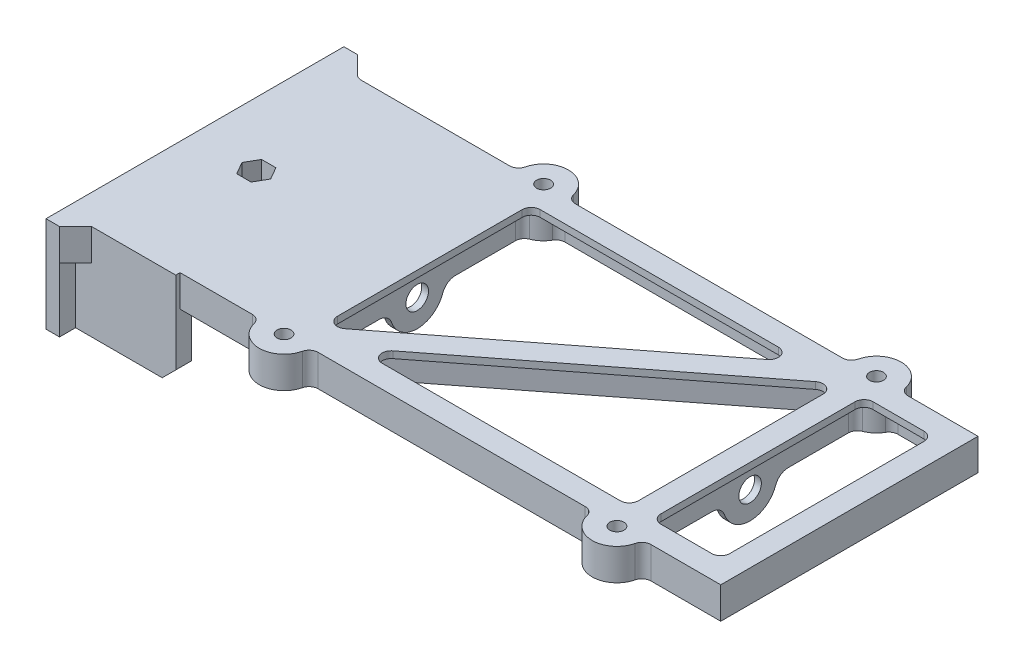
from build123d import *
from build123d.topology import SkipClean

# Parameters (mm, degrees)
SKETCH1_W            = 145
SKETCH1_H            = 57
BOSS_EXTRUDE1_DEPTH  = 1.5
SKETCH2_W            = 3
SKETCH2_H            = 66
BOSS_EXTRUDE2_DEPTH  = 21.2
CHAMFER1_SIZE        = 4.5
SKETCH3_W            = 9.5
SKETCH3_H            = 63
SKETCH3_R            = 1.55
BOSS_EXTRUDE3_DEPTH  = 1.5
SKETCH4_R            = 1.55
CUT_EXTRUDE1_DEPTH   = 83.056931456
SKETCH5_W            = 6
SKETCH5_H            = 9.5
BOSS_EXTRUDE4_DEPTH  = 19.7
CUT_EXTRUDE2_START   = -1
SKETCH6_W            = 5.5
SKETCH6_H            = 5.5
CUT_EXTRUDE2_DEPTH   = 1.8
CUT_EXTRUDE3_REACH   = 84.43
SKETCH7_R            = 1.6
SKETCH10_W           = 15.25
SKETCH10_H           = 47
CUT_EXTRUDE6_DEPTH   = 83.056931456
FILLET1_R            = 2
BOSS_EXTRUDE5_START  = 5.5
SKETCH11_W           = 9.5
SKETCH11_H           = 5
SKETCH11_R           = 1.55
BOSS_EXTRUDE5_DEPTH  = 5.5
SKETCH12_W           = 64.25
SKETCH12_H           = 1.5
SKETCH12_W_2         = 1.5
SKETCH12_H_2         = 53
BOSS_EXTRUDE6_DEPTH  = 5.5
BOSS_EXTRUDE7_START  = -7
SKETCH13_R           = 5.4886246
BOSS_EXTRUDE7_DEPTH  = 7
SKETCH14_R           = 3.125
CUT_EXTRUDE7_DEPTH   = 3
SKETCH15_R           = 1.55
CUT_EXTRUDE8_DEPTH   = 83.002276886
FILLET2_R            = 2
FILLET3_R            = 1
SKETCH20_R           = 6
BOSS_EXTRUDE9_DEPTH  = 1.5
BOSS_EXTRUDE10_START = -73.75
SKETCH20_2_R         = 6
BOSS_EXTRUDE10_DEPTH = 1.5
CUT_EXTRUDE13_REACH  = 129.76
SKETCH21_R           = 2.5
CUT_EXTRUDE14_START  = 72.25
SKETCH21_2_R         = 2.5
CUT_EXTRUDE14_DEPTH  = 1.5
FILLET4_R            = 3
SKETCH25_R           = 1.6
CUT_EXTRUDE16_DEPTH  = 3
SKETCH27_W           = 13
SKETCH27_H           = 6.35
CUT_EXTRUDE18_DEPTH  = 3
SKETCH26_R           = 3.125
CUT_EXTRUDE17_DEPTH  = 2
SKETCH29_W           = 13
SKETCH29_H           = 1.5
CUT_EXTRUDE19_DEPTH  = 3
SKETCH28_W           = 2
SKETCH28_H           = 14
BOSS_EXTRUDE13_DEPTH = 1
CHAMFER3_SIZE        = 1
CUT_EXTRUDE15_DEPTH  = 3
BOSS_EXTRUDE11_START = -1.5
SKETCH23_W           = 16.2
SKETCH23_H           = 3
SKETCH23_W_2         = 19.2
SKETCH23_H_2         = 3.5
BOSS_EXTRUDE11_DEPTH = 7
SKETCH30_W           = 19.2
SKETCH30_H           = 21.2
BOSS_EXTRUDE14_DEPTH = 3.5
SKETCH31_W           = 6.852894631
SKETCH31_H           = 16.7
CUT_EXTRUDE20_DEPTH  = 1
SKETCH33_W           = 19.2
SKETCH33_H           = 14.2
SKETCH33_W_2         = 10.2
SKETCH33_H_2         = 3.2
BOSS_EXTRUDE15_DEPTH = 3.5
BOSS_EXTRUDE16_DEPTH = 5.5
CUT_EXTRUDE21_START  = -7
CUT_EXTRUDE21_DEPTH  = 5
SKETCH36_R           = 1.6
CUT_EXTRUDE22_DEPTH  = 82.425876811
BOSS_EXTRUDE17_REACH = 100.492
SKETCH37_W           = 3
SKETCH37_H           = 21.2
SKETCH38_W           = 5.5
SKETCH38_H           = 1.8
CUT_EXTRUDE23_DEPTH  = 0.1
SKETCH39_W           = 10.2
SKETCH39_H           = 3.2
BOSS_EXTRUDE18_DEPTH = 0.8
CHAMFER4_SIZE        = 3
SKETCH40_W           = 15
SKETCH40_H           = 2.5
SKETCH40_W_2         = 2.35
SKETCH40_H_2         = 15
SKETCH40_H_3         = 1.5
BOSS_EXTRUDE19_DEPTH = 1.2
SKETCH41_W           = 15
SKETCH41_H           = 2.5
SKETCH41_W_2         = 2.35
SKETCH41_H_2         = 15
BOSS_EXTRUDE20_DEPTH = 1.5


# Some blends are built 0.0001 mm under size
with BuildPart() as part:
    # Sketch1 → Boss-Extrude1 (new body)
    with BuildSketch(Plane(origin=(0, 0, 0), x_dir=(1, 0, 0), z_dir=(0, 1, 0))):
        Rectangle(SKETCH1_W, SKETCH1_H)
    extrude(amount=BOSS_EXTRUDE1_DEPTH)

    # Sketch2 → Boss-Extrude2 (add)
    with BuildSketch(Plane(origin=(0, 1.5, 0), x_dir=(1, 0, 0), z_dir=(0, 1, 0))):
        with Locations((-71, 0)):
            Rectangle(SKETCH2_W, SKETCH2_H)
    extrude(amount=-BOSS_EXTRUDE2_DEPTH)

    # Chamfer1
    chamfer1_edges = [part.edges().sort_by_distance(p)[0] for p in [
        (-69.5, 0.75, -28.5),
        (-69.5, 0.75, 28.5),
    ]]
    chamfer(chamfer1_edges, length=CHAMFER1_SIZE - 0.0001)  # a hair under: the kernel refuses the full size

    # Sketch3 → Boss-Extrude3 (add)
    # profile 1 of 2: a face of its own
    with BuildSketch(Plane.XZ):
        with Locations((49.75, 0)):
            Rectangle(SKETCH3_W, SKETCH3_H)
        with Locations((49.75, 28.75)):
            Circle(SKETCH3_R, mode=Mode.SUBTRACT)
        with Locations((49.75, -28.75)):
            Circle(SKETCH3_R, mode=Mode.SUBTRACT)
    # profile 2 of 2: a face of its own
    with BuildSketch(Plane.XZ):
        with Locations((-24, 0)):
            Rectangle(SKETCH3_W, SKETCH3_H)
        with Locations((-24, -28.75)):
            Circle(SKETCH3_R, mode=Mode.SUBTRACT)
        with Locations((-24, 28.75)):
            Circle(SKETCH3_R, mode=Mode.SUBTRACT)
    extrude(amount=-BOSS_EXTRUDE3_DEPTH)

    # Sketch4 → Cut-Extrude1 (cut, through all)
    with BuildSketch(Plane.XZ):
        with Locations(Location((49.75, 28.75, 0), (0, 0, 270))):
            Circle(SKETCH4_R)
        with Locations(Location((49.75, -28.75, 0), (0, 0, 270))):
            Circle(SKETCH4_R)
        with Locations(Location((-24, -28.75, 0), (0, 0, 270))):
            Circle(SKETCH4_R)
        with Locations(Location((-24, 28.75, 0), (0, 0, 270))):
            Circle(SKETCH4_R)
    extrude(amount=-CUT_EXTRUDE1_DEPTH, mode=Mode.SUBTRACT)

    # Sketch5 → Boss-Extrude4 (add)
    with BuildSketch(Plane.XZ.offset(19.7)):
        with Locations((-69.5, 0)):
            Rectangle(SKETCH5_W, SKETCH5_H)
    extrude(amount=-BOSS_EXTRUDE4_DEPTH)

    # Sketch6 → Cut-Extrude2 (cut)
    with BuildSketch(Plane.XZ.offset(19.7).offset(CUT_EXTRUDE2_START)):
        with Locations((-69.25, 0)):
            Rectangle(SKETCH6_W, SKETCH6_H)
    extrude(amount=-CUT_EXTRUDE2_DEPTH, mode=Mode.SUBTRACT)

    # Cut-Extrude3: up to this face of the body (flat: up to its plane)
    cut_extrude3_end = Plane(part.part.faces().sort_by_distance((1.686884961, 0, 0))[0])
    # Sketch7 → Cut-Extrude3 (cut, up to the picked face)
    with BuildSketch(Plane.XZ.offset(19.7), mode=Mode.PRIVATE) as cut_extrude3_sk1:
        with Locations(Location((-69.25, 0, 0), (0, 0, 270))):
            Circle(SKETCH7_R)
    cut_extrude3_tool1 = split(extrude(cut_extrude3_sk1.sketch, amount=-CUT_EXTRUDE3_REACH, mode=Mode.PRIVATE), bisect_by=cut_extrude3_end, keep=Keep.BOTH, mode=Mode.PRIVATE)
    add(cut_extrude3_tool1.solids().sort_by(Axis((-69.25, -19.7, 0), (0, 1, 0)))[0], mode=Mode.SUBTRACT)

    # Sketch10 → Cut-Extrude6 (cut, through all)
    with BuildSketch(Plane.XZ):
        Polygon((-21.5, 23.5), (39.092146805, -23.5), (-21.5, -23.5), align=None)
        Polygon((47.25, -23.5), (47.25, 23.5), (-13.342146805, 23.5), align=None)
        with Locations((59.875, 0)):
            Rectangle(SKETCH10_W, SKETCH10_H)
    extrude(amount=-CUT_EXTRUDE6_DEPTH, mode=Mode.SUBTRACT)

    # Fillet1
    fillet1_edges = [part.edges().sort_by_distance(p)[0] for p in [
        (52.25, 0.75, -23.5),
        (52.25, 0.75, 23.5),
        (67.5, 0.75, 23.5),
        (67.5, 0.75, -23.5),
        (47.25, 0.75, -23.5),
        (-13.342146805, 0.75, 23.5),
        (47.25, 0.75, 23.5),
        (-21.5, 0.75, -23.5),
        (-21.5, 0.75, 23.5),
        (39.092146805, 0.75, -23.5),
    ]]
    fillet(fillet1_edges, radius=FILLET1_R)

    # Sketch11 → Boss-Extrude5 (add)
    # profile 1 of 4: a face of its own
    with BuildSketch(Plane.XZ.offset(BOSS_EXTRUDE5_START)):
        with Locations((-24, 29)):
            Rectangle(SKETCH11_W, SKETCH11_H)
        with Locations(Location((-24, 28.75, 0), (0, 0, 270))):
            Circle(SKETCH11_R, mode=Mode.SUBTRACT)
    # profile 2 of 4: a face of its own
    with BuildSketch(Plane.XZ.offset(BOSS_EXTRUDE5_START)):
        with Locations((-24, -29)):
            Rectangle(SKETCH11_W, SKETCH11_H)
        with Locations(Location((-24, -28.75, 0), (0, 0, 270))):
            Circle(SKETCH11_R, mode=Mode.SUBTRACT)
    # profile 3 of 4: a face of its own
    with BuildSketch(Plane.XZ.offset(BOSS_EXTRUDE5_START)):
        with Locations((49.75, -29)):
            Rectangle(SKETCH11_W, SKETCH11_H)
        with Locations(Location((49.75, -28.75, 0), (0, 0, 270))):
            Circle(SKETCH11_R, mode=Mode.SUBTRACT)
    # profile 4 of 4: a face of its own
    with BuildSketch(Plane.XZ.offset(BOSS_EXTRUDE5_START)):
        with Locations((49.75, 29)):
            Rectangle(SKETCH11_W, SKETCH11_H)
        with Locations(Location((49.75, 28.75, 0), (0, 0, 270))):
            Circle(SKETCH11_R, mode=Mode.SUBTRACT)
    extrude(amount=-BOSS_EXTRUDE5_DEPTH)

    # Sketch12 → Boss-Extrude6 (add)
    with SkipClean():  # the faces are left unmerged after this step: merging them gives an invalid solid
        with BuildSketch(Plane.XZ.offset(5.5)):
            with Locations((12.875, -27.75)):
                Rectangle(SKETCH12_W, SKETCH12_H)
            with Locations((12.875, 27.75)):
                Rectangle(SKETCH12_W, SKETCH12_H)
            Polygon((-28.75, 28.5), (-65, 28.5), (-69.5, 33), (-70.560660172, 31.939339828), (-65.621320344, 27), (-28.75, 27), align=None)
            Polygon((54.5, 28.5), (72.5, 28.5), (72.5, -28.5), (54.5, -28.5), (54.5, -27), (71, -27), (71, 27), (54.5, 27), align=None)
            with Locations((-24, 0)):
                Rectangle(SKETCH12_W_2, SKETCH12_H_2)
            Polygon((-24.461149181, 28.158526051), (49.288850819, -29.341473949), (50.211149181, -28.158526051), (-23.538850819, 29.341473949), align=None)
            with Locations((49.75, 0)):
                Rectangle(SKETCH12_W_2, SKETCH12_H_2)
            Polygon((-69.5, -33), (-70.560660172, -31.939339828), (-65.621320344, -27), (-28.75, -27), (-28.75, -28.5), (-65, -28.5), align=None)
        extrude(amount=-BOSS_EXTRUDE6_DEPTH)

    # Sketch13 → Boss-Extrude7 (add)
    with SkipClean():  # the faces are left unmerged after this step: merging them gives an invalid solid
        with BuildSketch(Plane.XZ.offset(5.5).offset(BOSS_EXTRUDE7_START)):
            with Locations((-24, 28.75)):
                Circle(SKETCH13_R)
            with Locations((-24, -28.75)):
                Circle(SKETCH13_R)
            with Locations((49.75, -28.75)):
                Circle(SKETCH13_R)
            with Locations((49.75, 28.75)):
                Circle(SKETCH13_R)
        extrude(amount=BOSS_EXTRUDE7_DEPTH)

    # Sketch14 → Cut-Extrude7 (cut)
    with SkipClean():  # the faces are left unmerged after this step: merging them gives an invalid solid
        with BuildSketch(Plane.XZ.offset(5.5)):
            with Locations(Location((49.75, -28.75, 0), (0, 0, 270))):
                Circle(SKETCH14_R)
            with Locations(Location((49.75, 28.75, 0), (0, 0, 270))):
                Circle(SKETCH14_R)
            with Locations(Location((-24, -28.75, 0), (0, 0, 270))):
                Circle(SKETCH14_R)
            with Locations(Location((-24, 28.75, 0), (0, 0, 270))):
                Circle(SKETCH14_R)
        extrude(amount=-CUT_EXTRUDE7_DEPTH, mode=Mode.SUBTRACT)

    # Sketch15 → Cut-Extrude8 (cut, through all)
    with SkipClean():  # the faces are left unmerged after this step: merging them gives an invalid solid
        with BuildSketch(Plane.XZ.offset(2.5)):
            with Locations(Location((49.75, 28.75, 0), (0, 0, 270))):
                Circle(SKETCH15_R)
            with Locations(Location((49.75, -28.75, 0), (0, 0, 270))):
                Circle(SKETCH15_R)
            with Locations(Location((-24, -28.75, 0), (0, 0, 270))):
                Circle(SKETCH15_R)
            with Locations(Location((-24, 28.75, 0), (0, 0, 270))):
                Circle(SKETCH15_R)
        extrude(amount=-CUT_EXTRUDE8_DEPTH, mode=Mode.SUBTRACT)

    # Fillet2
    # the kernel refuses this fillet: 2 mm, written as the material it adds along each edge
    with BuildSketch(Plane(origin=(-65, -5.5, -28.5), x_dir=(-0.7071067811865518, 0, -0.7071067811865432), z_dir=(0, 1, 0))) as fillet2_piece_1:
        with BuildLine():
            CenterArc((FILLET2_R * 0.414213562373, -FILLET2_R), FILLET2_R, 90, 45)
            Line((-FILLET2_R * 0.292893218813, -FILLET2_R * 0.292893218813), (0, 0))
            Line((0, 0), (FILLET2_R * 0.414213562373, 0))
        make_face()
    extrude(amount=5.5)
    with BuildSketch(Plane(origin=(-65, -5.5, 28.5), x_dir=(-0.7071067811865455, 0, 0.7071067811865497), z_dir=(0, 1, 0))) as fillet2_piece_2:
        with BuildLine():
            CenterArc((FILLET2_R * 0.414213562373, FILLET2_R), FILLET2_R, 225, 45)
            Line((-FILLET2_R * 0.292893218813, FILLET2_R * 0.292893218813), (0, 0))
            Line((0, 0), (FILLET2_R * 0.414213562373, 0))
        make_face()
    extrude(amount=5.5)
    with BuildSketch(Plane(origin=(-18.51707195, -5.5, 28.5), x_dir=(1, 0, 0), z_dir=(0, 1, 0)), Plane(origin=(-29.48292805, -5.5, -28.5), x_dir=(-1, 0, 0), z_dir=(0, 1, 0)), Plane(origin=(44.26707195, -5.5, -28.5), x_dir=(-1, 0, 0), z_dir=(0, 1, 0)), Plane(origin=(55.23292805, -5.5, 28.5), x_dir=(1, 0, 0), z_dir=(0, 1, 0))) as fillet2_piece_3:
        with BuildLine():
            CenterArc((1.798349201, -2), FILLET2_R, 90, 76.485715936)
            ThreePointArc((-0.146274182, -1.532624455), (-0.019131508, -0.771466538), (0, 0))
            Line((0, 0), (1.798349201, 0))
        make_face()
    extrude(amount=5.5)
    with BuildSketch(Plane(origin=(-29.48292805, -5.5, 28.5), x_dir=(-1, 0, 0), z_dir=(0, 1, 0)), Plane(origin=(-18.51707195, -5.5, -28.5), x_dir=(1, 0, 0), z_dir=(0, 1, 0)), Plane(origin=(55.23292805, -5.5, -28.5), x_dir=(1, 0, 0), z_dir=(0, 1, 0)), Plane(origin=(44.26707195, -5.5, 28.5), x_dir=(-1, 0, 0), z_dir=(0, 1, 0))) as fillet2_piece_4:
        with BuildLine():
            CenterArc((1.798349201, 2), FILLET2_R, 193.514284064, 76.485715936)
            ThreePointArc((-0.146274182, 1.532624455), (-0.019131508, 0.771466538), (0, 0))
            Line((0, 0), (1.798349201, 0))
        make_face()
    extrude(amount=5.5)
    with BuildSketch(Plane(origin=(-29.202163012, -5.5, 27), x_dir=(-1, 0, 0), z_dir=(0, 1, 0))) as fillet2_piece_5:
        with BuildLine():
            CenterArc((1.279889009, -2), FILLET2_R, 90, 59.949738358)
            ThreePointArc((-0.451283901, -0.998480976), (-0.200662943, -0.510530261), (0, 0))
            Line((0, 0), (1.279889009, 0))
        make_face()
    extrude(amount=5.5)
    with BuildSketch(Plane(origin=(-24.75, -5.5, 23.312859207), x_dir=(0, 0, -1), z_dir=(0, 1, 0)), Plane(origin=(-20.17324633, -5.5, 24.815415353), x_dir=(0.7886319326366397, 0, -0.6148655745980567), z_dir=(0, 1, 0)), Plane(origin=(49, -5.5, 23.312859207), x_dir=(0, 0, -1), z_dir=(0, 1, 0))) as fillet2_piece_6:
        with BuildLine():
            CenterArc((1.528273653, 2), FILLET2_R, 201.544493666, 68.455506334)
            ThreePointArc((-0.331991701, 1.265552716), (-0.128150783, 0.642704232), (0, 0))
            Line((0, 0), (1.528273653, 0))
        make_face()
    extrude(amount=5.5)
    with BuildSketch(Plane(origin=(-23.25, -5.5, 23.312859207), x_dir=(0.9672714744497951, 0, 0.2537437579837566), z_dir=(0, 1, 0)), Plane(origin=(-24.75, -5.5, -23.312859207), x_dir=(-0.9672714744497954, 0, -0.253743757983756), z_dir=(0, 1, 0)), Plane(origin=(49, -5.5, -23.312859207), x_dir=(-0.9672714744497944, 0, -0.25374375798375987), z_dir=(0, 1, 0)), Plane(origin=(50.5, -5.5, 23.312859207), x_dir=(0.9672714744497954, 0, 0.253743757983756), z_dir=(0, 1, 0))) as fillet2_piece_7:
        with BuildLine():
            CenterArc((1.546753049, 1.985743026), FILLET2_R, 194.699159663, 68.455506334)
            Line((-0.3877899, 1.47825551), (0, 0))
            ThreePointArc((0, 0), (0.654186932, 0.03912559), (1.308373863, 0))
        make_face()
    extrude(amount=5.5)
    with BuildSketch(Plane(origin=(-18.797836988, -5.5, 27), x_dir=(1, 0, 0), z_dir=(0, 1, 0)), Plane(origin=(-29.202163012, -5.5, -27), x_dir=(-1, 0, 0), z_dir=(0, 1, 0)), Plane(origin=(44.547836988, -5.5, -27), x_dir=(-1, 0, 0), z_dir=(0, 1, 0)), Plane(origin=(54.952163012, -5.5, 27), x_dir=(1, 0, 0), z_dir=(0, 1, 0))) as fillet2_piece_8:
        with BuildLine():
            CenterArc((1.279889009, 2), FILLET2_R, 210.050261642, 59.949738358)
            ThreePointArc((-0.451283901, 0.998480976), (-0.200662943, 0.510530261), (0, 0))
            Line((0, 0), (1.279889009, 0))
        make_face()
    extrude(amount=5.5)
    with BuildSketch(Plane(origin=(-18.797836988, -5.5, -27), x_dir=(-0.41185732786672785, 0, 0.9112483423757097), z_dir=(0, 1, 0)), Plane(origin=(54.952163012, -5.5, -27), x_dir=(-0.4118573278667254, 0, 0.9112483423757108), z_dir=(0, 1, 0)), Plane(origin=(44.547836988, -5.5, 27), x_dir=(0.4118573278667266, 0, -0.9112483423757102), z_dir=(0, 1, 0))) as fillet2_piece_9:
        with BuildLine():
            CenterArc((1.295365017, 1.990011394), FILLET2_R, 204.32156275, 59.949738358)
            Line((-0.527131667, 1.166296738), (0, 0))
            ThreePointArc((0, 0), (0.547864358, 0.027411855), (1.095728716, 0))
        make_face()
    extrude(amount=5.5)
    with BuildSketch(Plane(origin=(-23.25, -5.5, -23.312859207), x_dir=(0.9672714744497951, 0, -0.2537437579837566), z_dir=(0, 1, 0)), Plane(origin=(50.5, -5.5, -23.312859207), x_dir=(0.9672714744497961, 0, -0.2537437579837534), z_dir=(0, 1, 0)), Plane(origin=(45.92324633, -5.5, -24.815415353), x_dir=(0.7948523611830938, 0, 0.6068028707262851), z_dir=(0, 1, 0))) as fillet2_piece_10:
        with BuildLine():
            CenterArc((1.546753049, -1.985743026), FILLET2_R, 96.845334003, 68.455506334)
            Line((-0.3877899, -1.47825551), (0, 0))
            ThreePointArc((0, 0), (0.654186932, -0.03912559), (1.308373863, 0))
        make_face()
    extrude(amount=5.5)
    with BuildSketch(Plane(origin=(55.23292805, 0, 28.5), x_dir=(1, 0, 0), z_dir=(0, 1, 0)), Plane(origin=(44.26707195, 0, -28.5), x_dir=(-1, 0, 0), z_dir=(0, 1, 0)), Plane(origin=(-29.48292805, 0, -28.5), x_dir=(-1, 0, 0), z_dir=(0, 1, 0)), Plane(origin=(-18.51707195, 0, 28.5), x_dir=(1, 0, 0), z_dir=(0, 1, 0))) as fillet2_piece_11:
        with BuildLine():
            CenterArc((1.798349201, -2), FILLET2_R, 90, 76.485715936)
            ThreePointArc((-0.146274182, -1.532624455), (-0.019131508, -0.771466538), (0, 0))
            Line((0, 0), (1.798349201, 0))
        make_face()
    extrude(amount=1.5)
    with BuildSketch(Plane(origin=(44.26707195, 0, 28.5), x_dir=(-1, 0, 0), z_dir=(0, 1, 0)), Plane(origin=(55.23292805, 0, -28.5), x_dir=(1, 0, 0), z_dir=(0, 1, 0)), Plane(origin=(-18.51707195, 0, -28.5), x_dir=(1, 0, 0), z_dir=(0, 1, 0)), Plane(origin=(-29.48292805, 0, 28.5), x_dir=(-1, 0, 0), z_dir=(0, 1, 0))) as fillet2_piece_12:
        with BuildLine():
            CenterArc((1.798349201, 2), FILLET2_R, 193.514284064, 76.485715936)
            ThreePointArc((-0.146274182, 1.532624455), (-0.019131508, 0.771466538), (0, 0))
            Line((0, 0), (1.798349201, 0))
        make_face()
    extrude(amount=1.5)
    with BuildSketch(Plane(origin=(-65.0001, 0, 28.5), x_dir=(1, 0, 0), z_dir=(0, 1, 0))) as fillet2_piece_13:
        with BuildLine():
            CenterArc((FILLET2_R * 0.414213562373, -FILLET2_R), FILLET2_R, 90, 45)
            Line((-FILLET2_R * 0.292893218813, -FILLET2_R * 0.292893218813), (0, 0))
            Line((0, 0), (FILLET2_R * 0.414213562373, 0))
        make_face()
    extrude(amount=1.5)
    with BuildSketch(Plane(origin=(-65.0001, 1.5, -28.5), x_dir=(-0.7071067811865432, 0, -0.7071067811865518), z_dir=(0, -1, 0))) as fillet2_piece_14:
        with BuildLine():
            CenterArc((FILLET2_R * 0.414213562373, FILLET2_R), FILLET2_R, 225, 45)
            Line((-FILLET2_R * 0.292893218813, FILLET2_R * 0.292893218813), (0, 0))
            Line((0, 0), (FILLET2_R * 0.414213562373, 0))
        make_face()
    extrude(amount=1.5)
    # the kernel refuses this fillet: 2 mm, written as the material it takes off along each edge
    with BuildSketch(Plane(origin=(-65.621320344, -7.571067812, 27), x_dir=(-0.7071067811865539, 0, 0.7071067811865411), z_dir=(0, 1, 0))) as fillet2_2_piece_1:
        with BuildLine():
            CenterArc((FILLET2_R * 0.414213562373, FILLET2_R), FILLET2_R, 225, 45)
            Line((-FILLET2_R * 0.292893218813, FILLET2_R * 0.292893218813), (0, 0))
            Line((0, 0), (FILLET2_R * 0.414213562373, 0))
        make_face()
    extrude(amount=7.571067812, mode=Mode.SUBTRACT)
    with BuildSketch(Plane(origin=(-65.621320344, -7.571067812, -27), x_dir=(-0.7071067811865583, 0, -0.7071067811865369), z_dir=(0, 1, 0))) as fillet2_2_piece_2:
        with BuildLine():
            CenterArc((FILLET2_R * 0.414213562373, -FILLET2_R), FILLET2_R, 90, 45)
            Line((-FILLET2_R * 0.292893218813, -FILLET2_R * 0.292893218813), (0, 0))
            Line((0, 0), (FILLET2_R * 0.414213562373, 0))
        make_face()
    extrude(amount=7.571067812, mode=Mode.SUBTRACT)

    # Fillet3
    fillet3_edges = [part.edges().sort_by_distance(p)[0] for p in [
        (-69.5, -2.75, 30.878679656),
        (-69.5, -2.75, -30.878679656),
    ]]
    fillet(fillet3_edges, radius=FILLET3_R)

    # Sketch20 → Boss-Extrude9 (add)
    with SkipClean():  # the faces are left unmerged after this step: merging them gives an invalid solid
        with BuildSketch(Plane(origin=(50.5, 0, 0), x_dir=(0, 0, -1), z_dir=(1, 0, 0))):
            with Locations((0, -5.5)):
                Circle(SKETCH20_R)
        extrude(amount=-BOSS_EXTRUDE9_DEPTH)

    # Sketch20<2> → Boss-Extrude10 (add)
    with SkipClean():  # the faces are left unmerged after this step: merging them gives an invalid solid
        with BuildSketch(Plane(origin=(50.5, 0, 0), x_dir=(0, 0, -1), z_dir=(1, 0, 0)).offset(BOSS_EXTRUDE10_START)):
            with Locations((0, -5.5)):
                Circle(SKETCH20_2_R)
        extrude(amount=-BOSS_EXTRUDE10_DEPTH)

    # Sketch21 → Cut-Extrude13 (cut, up to next)
    with BuildSketch(Plane.ZY.offset(-49), mode=Mode.PRIVATE) as cut_extrude13_sk1:
        with Locations((0, -5.5)):
            Circle(SKETCH21_R)
    cut_extrude13_tool1 = extrude(cut_extrude13_sk1.sketch, amount=-CUT_EXTRUDE13_REACH, mode=Mode.PRIVATE) & part.part
    add(cut_extrude13_tool1.solids().sort_by_distance((49, -5.5, 0))[0], mode=Mode.SUBTRACT)

    # Sketch21<2> → Cut-Extrude14 (cut)
    with SkipClean():  # the faces are left unmerged after this step: merging them gives an invalid solid
        with BuildSketch(Plane.ZY.offset(-49).offset(CUT_EXTRUDE14_START)):
            with Locations((0, -5.5)):
                Circle(SKETCH21_2_R)
        extrude(amount=CUT_EXTRUDE14_DEPTH, mode=Mode.SUBTRACT)

    # Fillet4
    # the kernel refuses this fillet: 3 mm, written as the material it adds along each edge
    with BuildSketch(Plane(origin=(50.5, -5.5, -6), x_dir=(0, 0, -1), z_dir=(-1, 0, 0)), Plane(origin=(49, -5.5, 6), x_dir=(0, 0, 1), z_dir=(1, 0, 0)), Plane(origin=(-23.25, -5.5, -6), x_dir=(0, 0, -1), z_dir=(-1, 0, 0)), Plane(origin=(-24.75, -5.5, 6), x_dir=(0, 0, 1), z_dir=(1, 0, 0))) as fillet4_piece_1:
        with BuildLine():
            CenterArc((2.485281374, 3), FILLET4_R, 199.471220634, 70.528779366)
            ThreePointArc((-0.343145751, 2), (-0.086408642, 1.014611872), (0, 0))
            Line((0, 0), (2.485281374, 0))
        make_face()
    extrude(amount=1.5)

    # Sketch25 → Cut-Extrude16 (cut)
    with SkipClean():  # the faces are left unmerged after this step: merging them gives an invalid solid
        with BuildSketch(Plane.ZY.offset(72.5)):
            with Locations((-16, -13.5)):
                Circle(SKETCH25_R)
        extrude(amount=-CUT_EXTRUDE16_DEPTH, mode=Mode.SUBTRACT)

    # Sketch27 → Cut-Extrude18 (cut)
    with SkipClean():  # the faces are left unmerged after this step: merging them gives an invalid solid
        with BuildSketch(Plane.ZY.offset(72.5)):
            with Locations((-16, -3.025)):
                Rectangle(SKETCH27_W, SKETCH27_H)
        extrude(amount=-CUT_EXTRUDE18_DEPTH, mode=Mode.SUBTRACT)

    # Sketch26 → Cut-Extrude17 (cut)
    with SkipClean():  # the faces are left unmerged after this step: merging them gives an invalid solid
        with BuildSketch(Plane.ZY.offset(72.5)):
            with Locations((-16, -13.5)):
                Circle(SKETCH26_R)
        extrude(amount=-CUT_EXTRUDE17_DEPTH, mode=Mode.SUBTRACT)

    # Sketch29 → Cut-Extrude19 (cut)
    with SkipClean():  # the faces are left unmerged after this step: merging them gives an invalid solid
        with BuildSketch(Plane.ZY.offset(72.5)):
            with Locations((-16, -6.95)):
                Rectangle(SKETCH29_W, SKETCH29_H)
        extrude(amount=-CUT_EXTRUDE19_DEPTH, mode=Mode.SUBTRACT)

    # Sketch28 → Boss-Extrude13 (add)
    with SkipClean():  # the faces are left unmerged after this step: merging them gives an invalid solid
        with BuildSketch(Plane.XZ):
            with Locations((-66.8, -16)):
                Rectangle(SKETCH28_W, SKETCH28_H)
        extrude(amount=BOSS_EXTRUDE13_DEPTH)

    # Chamfer3
    chamfer3_edges = [part.edges().sort_by_distance(p)[0] for p in [
        (-65.8, 0, -16),
    ]]
    chamfer(chamfer3_edges, length=CHAMFER3_SIZE - 0.0001)  # a hair under: the kernel refuses the full size

    # Sketch22 → Cut-Extrude15 (cut)
    with SkipClean():  # the faces are left unmerged after this step: merging them gives an invalid solid
        with BuildSketch(Plane.ZY.offset(72.5)):
            Polygon((4.75, -3.5), (4.75, -13.7), (22.851440659, -13.7), (25.95, -11.1), (25.95, -6.1), (22.851440659, -3.5), align=None)
        extrude(amount=-CUT_EXTRUDE15_DEPTH, mode=Mode.SUBTRACT)

    # Sketch23 → Boss-Extrude11 (add)
    with SkipClean():  # the faces are left unmerged after this step: merging them gives an invalid solid
        with BuildSketch(Plane(origin=(0, 0, 0), x_dir=(-1, 0, 0), z_dir=(0, -1, 0)).offset(BOSS_EXTRUDE11_START)):
            with Locations((58.4, -3.25)):
                Rectangle(SKETCH23_W, SKETCH23_H)
            with Locations((59.9, -27.7)):
                Rectangle(SKETCH23_W_2, SKETCH23_H_2)
        extrude(amount=BOSS_EXTRUDE11_DEPTH)

    # Sketch30 → Boss-Extrude14 (add)
    with SkipClean():  # the faces are left unmerged after this step: merging them gives an invalid solid
        with BuildSketch(Plane.XZ):
            with Locations((-59.9, 15.35)):
                Rectangle(SKETCH30_W, SKETCH30_H)
        extrude(amount=BOSS_EXTRUDE14_DEPTH)

    # Sketch31 → Cut-Extrude20 (cut)
    with SkipClean():  # the faces are left unmerged after this step: merging them gives an invalid solid
        with BuildSketch(Plane.XZ.offset(3.5)):
            with Locations((-55.473552685, 15.35)):
                Rectangle(SKETCH31_W, SKETCH31_H)
        extrude(amount=-CUT_EXTRUDE20_DEPTH, mode=Mode.SUBTRACT)

    # Sketch33 → Boss-Extrude15 (add)
    with SkipClean():  # the faces are left unmerged after this step: merging them gives an invalid solid
        with BuildSketch(Plane.XY.offset(29.45)):
            with Locations((-59.9, -12.6)):
                Rectangle(SKETCH33_W, SKETCH33_H)
            with Locations((-58.8, -14.9)):
                Rectangle(SKETCH33_W_2, SKETCH33_H_2, mode=Mode.SUBTRACT)
        extrude(amount=-BOSS_EXTRUDE15_DEPTH)

    # Sketch34 → Boss-Extrude16 (add)
    with SkipClean():  # the faces are left unmerged after this step: merging them gives an invalid solid
        with BuildSketch(Plane.XZ.offset(5.5)):
            with BuildLine():
                Line((-64.4, 1.75), (-52.4, 1.75))
                Line((-52.4, 1.75), (-52.4, 0.5))
                ThreePointArc((-52.4, 0.5), (-58.4, -5.5), (-64.4, 0.5))
                Line((-64.4, 0.5), (-64.4, 1.75))
            make_face()
        extrude(amount=-BOSS_EXTRUDE16_DEPTH)

    # Sketch35 → Cut-Extrude21 (cut)
    with SkipClean():  # the faces are left unmerged after this step: merging them gives an invalid solid
        with BuildSketch(Plane.XZ.offset(5.5).offset(CUT_EXTRUDE21_START)):
            Polygon((-56.81228676, 3.25), (-59.98771324, 3.25), (-61.575426481, 0.5), (-59.98771324, -2.25), (-56.81228676, -2.25), (-55.224573519, 0.5), align=None)
        extrude(amount=CUT_EXTRUDE21_DEPTH, mode=Mode.SUBTRACT)

    # Sketch36 → Cut-Extrude22 (cut, through all)
    with SkipClean():  # the faces are left unmerged after this step: merging them gives an invalid solid
        with BuildSketch(Plane.XZ.offset(5.5)):
            with Locations(Location((-58.4, 0.5, 0), (0, 0, 270))):
                Circle(SKETCH36_R)
        extrude(amount=-CUT_EXTRUDE22_DEPTH, mode=Mode.SUBTRACT)

    # Boss-Extrude17: up to this face of the body (flat: up to its plane)
    boss_extrude17_end = Plane(part.part.faces().sort_by_distance((-60.0496, -12.2872, 25.95))[0])
    # Sketch37 → Boss-Extrude17 (add, up to the picked face)
    with BuildSketch(Plane.XY.offset(29.45), mode=Mode.PRIVATE) as boss_extrude17_sk1:
        with Locations((-48.8, -9.1)):
            Rectangle(SKETCH37_W, SKETCH37_H)
    boss_extrude17_tool1 = split(extrude(boss_extrude17_sk1.sketch, amount=-BOSS_EXTRUDE17_REACH, mode=Mode.PRIVATE), bisect_by=boss_extrude17_end, keep=Keep.BOTH, mode=Mode.PRIVATE)
    add(boss_extrude17_tool1.solids().sort_by(Axis((-48.8, -9.1, 29.45), (0, 0, -1)))[0])

    # Sketch38 → Cut-Extrude23 (cut)
    with SkipClean():  # the faces are left unmerged after this step: merging them gives an invalid solid
        with BuildSketch(Plane(origin=(-72, 0, 0), x_dir=(0, 0, -1), z_dir=(1, 0, 0))):
            with Locations((0, -17.8)):
                Rectangle(SKETCH38_W, SKETCH38_H)
        extrude(amount=-CUT_EXTRUDE23_DEPTH, mode=Mode.SUBTRACT)

    # Sketch39 → Boss-Extrude18 (add)
    with SkipClean():  # the faces are left unmerged after this step: merging them gives an invalid solid
        with BuildSketch(Plane.XY.offset(29.45)):
            with Locations((-58.8, -14.9)):
                Rectangle(SKETCH39_W, SKETCH39_H)
        extrude(amount=-BOSS_EXTRUDE18_DEPTH)

    # Chamfer4
    chamfer4_edges = [part.edges().sort_by_distance(p)[0] for p in [
        (-47.3, -19.7, 27.7),
    ]]
    chamfer(chamfer4_edges, length=CHAMFER4_SIZE - 0.0001)  # a hair under: the kernel refuses the full size

    # Sketch40 → Boss-Extrude19 (add)
    with SkipClean():  # the faces are left unmerged after this step: merging them gives an invalid solid
        with BuildSketch(Plane.XZ):
            with Locations((-38.85, 25.75)):
                Rectangle(SKETCH40_W, SKETCH40_H)
            with Locations((-25.925, 4.45)):
                Rectangle(SKETCH40_W_2, SKETCH40_H_2)
            with Locations((-38.85, -16.65)):
                Rectangle(SKETCH40_W, SKETCH40_H_3)
        extrude(amount=BOSS_EXTRUDE19_DEPTH)

    # Sketch41 → Boss-Extrude20 (add)
    with SkipClean():  # the faces are left unmerged after this step: merging them gives an invalid solid
        with BuildSketch(Plane.XZ.offset(1.2)):
            with Locations((-38.85, 25.75)):
                Rectangle(SKETCH41_W, SKETCH41_H)
            with Locations((-25.925, 4.45)):
                Rectangle(SKETCH41_W_2, SKETCH41_H_2)
        extrude(amount=BOSS_EXTRUDE20_DEPTH)


solid = part.part
